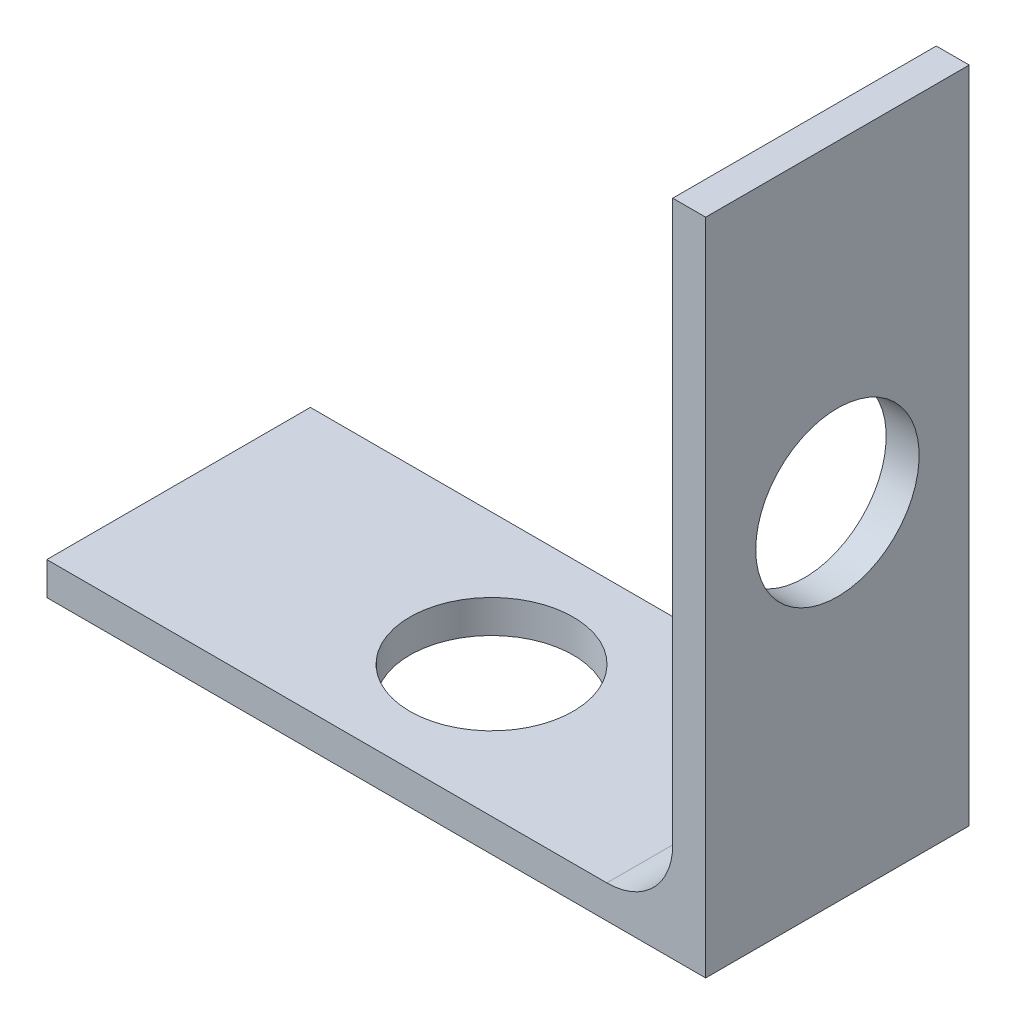
from build123d import *

# Parameters (mm, degrees)
BOSS_EXTRUDE1_DEPTH = 12.7
SKETCH2_R           = 3.937
CUT_EXTRUDE1_DEPTH  = 6.35
SKETCH4_R           = 3.937
CUT_EXTRUDE2_DEPTH  = 6.35
FILLET2_R           = 3.175


with BuildPart() as part:
    # Sketch1 → Boss-Extrude1 (new body)
    with BuildSketch(Plane.XY):
        Polygon((0, 0), (31.75, 0), (31.75, 31.75), (30.1625, 31.75), (30.1625, 1.5875), (0, 1.5875), align=None)
    extrude(amount=BOSS_EXTRUDE1_DEPTH)

    # Sketch2 → Cut-Extrude1 (cut)
    with BuildSketch(Plane.ZY.offset(-30.1625)):
        with Locations((6.35, 16.66875)):
            Circle(SKETCH2_R)
    extrude(amount=-CUT_EXTRUDE1_DEPTH, mode=Mode.SUBTRACT)

    # Sketch4 → Cut-Extrude2 (cut)
    with BuildSketch(Plane(origin=(0, 1.5875, 0), x_dir=(1, 0, 0), z_dir=(0, 1, 0))):
        with Locations((15.08125, -6.35)):
            Circle(SKETCH4_R)
    extrude(amount=-CUT_EXTRUDE2_DEPTH, mode=Mode.SUBTRACT)

    # Fillet2
    fillet2_edges = [part.edges().sort_by_distance(p)[0] for p in [
        (30.1625, 1.5875, 6.35),
    ]]
    fillet(fillet2_edges, radius=FILLET2_R)


solid = part.part
